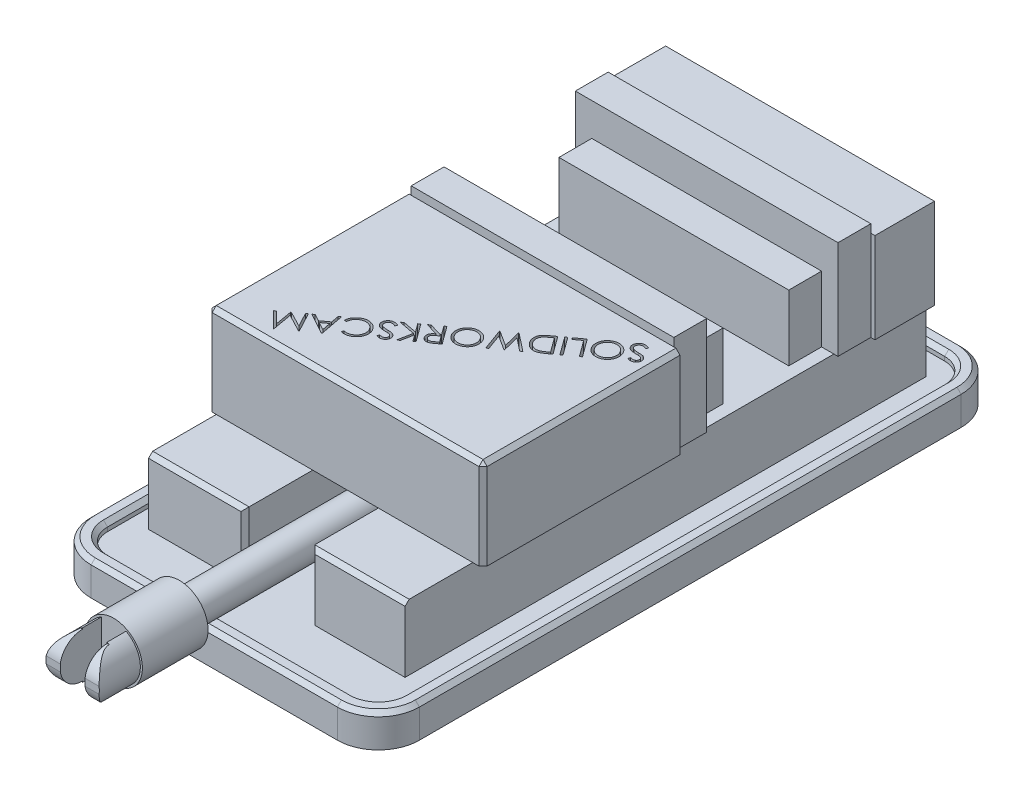
from build123d import *
from build123d.topology import SkipClean

# Parameters (mm, degrees)
SKETCH1_W               = 203.2
SKETCH1_H               = 76.2
BASE_EXTRUDE_DEPTH      = 25.4
SKETCH2_W               = 212.725
SKETCH2_H               = 69.85
BOSS_EXTRUDE1_DEPTH     = 152.4
SKETCH3_W               = 73.025
SKETCH3_H               = 406.4
SKETCH3_W_2             = 74.6125
BOSS_EXTRUDE2_DEPTH     = 50.8
SKETCH4_W               = 211.1375
SKETCH4_H               = 49.2125
BOSS_EXTRUDE3_DEPTH     = 69.85
SKETCH5_W               = 203.2
SKETCH5_H               = 76.2
BOSS_EXTRUDE4_DEPTH     = 25.4
BOSS_EXTRUDE5_DEPTH     = 19.05
BOSS_EXTRUDE6_START     = -25.4
BOSS_EXTRUDE6_DEPTH     = 25.4
BOSS_EXTRUDE7_DEPTH     = 50.8
SKETCH9_R               = 12.699199964
BOSS_EXTRUDE8_DEPTH     = 482.6
SKETCH10_R              = 22.225
BOSS_EXTRUDE9_DEPTH     = 50.8
BOSS_EXTRUDE10_DEPTH    = 31.75
CUT_EXTRUDE3_DEPTH      = 31.75
CUT_EXTRUDE3_DEPTH_BACK = 393.549301243
SKETCH19_W              = 177.8
SKETCH19_H              = 50.8
BOSS_EXTRUDE14_DEPTH    = 25.4
SKETCH20_W              = 177.8
SKETCH20_H              = 50.8
BOSS_EXTRUDE15_DEPTH    = 25.4
CHAMFER1_SIZE           = 3.175
CUT_EXTRUDE4_DEPTH      = 25.146


with BuildPart() as part:
    # Sketch1 → Base-Extrude (new body)
    with BuildSketch(Plane.XY):
        with Locations((0, 38.1)):
            Rectangle(SKETCH1_W, SKETCH1_H)
    extrude(amount=-BASE_EXTRUDE_DEPTH)

    # Sketch2 → Boss-Extrude1 (add)
    with BuildSketch(Plane.XY):
        with Locations((0, 34.925)):
            Rectangle(SKETCH2_W, SKETCH2_H)
    extrude(amount=BOSS_EXTRUDE1_DEPTH)

    # Sketch3 → Boss-Extrude2 (add)
    with BuildSketch(Plane.XZ):
        with Locations((61.9125, 1.5875)):
            Rectangle(SKETCH3_W, SKETCH3_H)
        with Locations((-62.70625, 1.5875)):
            Rectangle(SKETCH3_W_2, SKETCH3_H)
    extrude(amount=BOSS_EXTRUDE2_DEPTH)

    # Sketch4 → Boss-Extrude3 (add)
    with BuildSketch(Plane(origin=(0, 0, 0), x_dir=(-1, 0, 0), z_dir=(0, 1, 0))):
        with Locations((0.79375, -177.00625)):
            Rectangle(SKETCH4_W, SKETCH4_H)
    extrude(amount=BOSS_EXTRUDE3_DEPTH)

    # Sketch5 → Boss-Extrude4 (add)
    with BuildSketch(Plane.XY.offset(-152.4)):
        with Locations((0, 38.1)):
            Rectangle(SKETCH5_W, SKETCH5_H)
    extrude(amount=BOSS_EXTRUDE4_DEPTH)

    # Sketch6 → Boss-Extrude5 (add)
    with BuildSketch(Plane.XZ.offset(50.8)):
        with BuildLine():
            Line((-95.25, 254), (95.25, 254))
            ThreePointArc((95.25, 254), (117.700640303, 244.700640303), (127, 222.25))
            Line((127, 222.25), (127, -196.85))
            ThreePointArc((127, -196.85), (117.700640303, -219.300640303), (95.25, -228.6))
            Line((95.25, -228.6), (-95.25, -228.6))
            ThreePointArc((-95.25, -228.6), (-117.700640303, -219.300640303), (-127, -196.85))
            Line((-127, -196.85), (-127, 222.25))
            ThreePointArc((-127, 222.25), (-117.700640303, 244.700640303), (-95.25, 254))
        make_face()
    extrude(amount=BOSS_EXTRUDE5_DEPTH)

    # Sketch7 → Boss-Extrude6 (add)
    with SkipClean():  # the faces are left unmerged after this step: merging them gives an invalid solid
        with BuildSketch(Plane.XZ.offset(69.85).offset(BOSS_EXTRUDE6_START)):
            with BuildLine():
                Line((95.25, 254), (-95.25, 254))
                ThreePointArc((-95.25, 254), (-117.700640303, 244.700640303), (-127, 222.25))
                Line((-127, 222.25), (-127, -196.85))
                ThreePointArc((-127, -196.85), (-117.700640303, -219.300640303), (-95.25, -228.6))
                Line((-95.25, -228.6), (95.25, -228.6))
                ThreePointArc((95.25, -228.6), (117.700640303, -219.300640303), (127, -196.85))
                Line((127, -196.85), (127, 222.25))
                ThreePointArc((127, 222.25), (117.700640303, 244.700640303), (95.25, 254))
            make_face()
            with BuildLine():
                Line((95.25, 241.3), (-95.25, 241.3))
                ThreePointArc((-95.25, 241.3), (-108.720384182, 235.720384182), (-114.3, 222.25))
                Line((-114.3, 222.25), (-114.3, -196.85))
                ThreePointArc((-114.3, -196.85), (-108.720384182, -210.320384182), (-95.25, -215.9))
                Line((-95.25, -215.9), (95.25, -215.9))
                ThreePointArc((95.25, -215.9), (108.720384182, -210.320384182), (114.3, -196.85))
                Line((114.3, -196.85), (114.3, 222.25))
                ThreePointArc((114.3, 222.25), (108.720384182, 235.720384182), (95.25, 241.3))
            make_face(mode=Mode.SUBTRACT)
        extrude(amount=BOSS_EXTRUDE6_DEPTH)
    add(part.part.scale(1), mode=Mode.REPLACE)  # the faces are merged on a copy

    # Sketch8 → Boss-Extrude7 (add)
    with BuildSketch(Plane(origin=(0, 0, -201.6125), x_dir=(-1, 0, 0), z_dir=(0, 0, -1))):
        with BuildLine():
            Line((-19.05, 0), (19.05, 0))
            Line((19.05, 0), (19.05, -19.05254))
            ThreePointArc((19.05, -19.05254), (13.47112813, -32.52112813), (0.00254, -38.1))
            Line((0.00254, -38.1), (-0.00254, -38.1))
            ThreePointArc((-0.00254, -38.1), (-13.47112813, -32.52112813), (-19.05, -19.05254))
            Line((-19.05, -19.05254), (-19.05, 0))
        make_face()
    extrude(amount=-BOSS_EXTRUDE7_DEPTH)

    # Sketch9 → Boss-Extrude8 (add)
    with BuildSketch(Plane.XY.offset(-150.8125)):
        with Locations((-0.00254, -19.05254)):
            Circle(SKETCH9_R)
    extrude(amount=BOSS_EXTRUDE8_DEPTH)

    # Sketch10 → Boss-Extrude9 (add)
    with BuildSketch(Plane.XY.offset(331.7875)):
        with Locations((-0.00254, -19.05254)):
            Circle(SKETCH10_R)
    extrude(amount=-BOSS_EXTRUDE9_DEPTH)

    # Sketch12 → Boss-Extrude10 (add)
    with BuildSketch(Plane.XY.offset(331.7875)):
        with BuildLine():
            Line((-9.564689525, -0.762760718), (-9.564689525, -37.337239282))
            ThreePointArc((-9.564689525, -37.337239282), (-20.6375, -19.05), (-9.564689525, -0.762760718))
        make_face()
        with BuildLine():
            Line((9.559609525, -0.760104648), (9.559609525, -37.339895352))
            ThreePointArc((9.559609525, -37.339895352), (20.6375, -19.05), (9.559609525, -0.760104648))
        make_face()
    extrude(amount=BOSS_EXTRUDE10_DEPTH)

    # Sketch13 → Cut-Extrude3 (cut, two sides: drawn at the far end of the back side and taken through both)
    with BuildSketch(Plane(origin=(0, 0, 0), x_dir=(0, 0, -1), z_dir=(1, 0, 0)).offset(-CUT_EXTRUDE3_DEPTH_BACK)):
        with BuildLine():
            Line((-346.37408333, 4.528931237), (-346.37408333, -1.682007362))
            ThreePointArc((-346.37408333, -1.682007362), (-363.744615968, -19.05254), (-346.37408333, -36.423072638))
            Line((-346.37408333, -36.423072638), (-346.37408333, -44.712752589))
            Line((-346.37408333, -44.712752589), (-380.000690716, -44.712752589))
            Line((-380.000690716, -44.712752589), (-380.000690716, 4.528931237))
            Line((-380.000690716, 4.528931237), (-346.37408333, 4.528931237))
        make_face()
    extrude(amount=CUT_EXTRUDE3_DEPTH + CUT_EXTRUDE3_DEPTH_BACK, mode=Mode.SUBTRACT)

    # Sketch19 → Boss-Extrude14 (add)
    with BuildSketch(Plane.XY.offset(-127)):
        with Locations((0, 25.4)):
            Rectangle(SKETCH19_W, SKETCH19_H)
    extrude(amount=BOSS_EXTRUDE14_DEPTH)

    # Sketch20 → Boss-Extrude15 (add)
    with BuildSketch(Plane(origin=(0, 0, -25.4), x_dir=(-1, 0, 0), z_dir=(0, 0, -1))):
        with Locations((0, 25.4)):
            Rectangle(SKETCH20_W, SKETCH20_H)
    extrude(amount=BOSS_EXTRUDE15_DEPTH)

    # Chamfer1
    chamfer1_edges = [part.edges().sort_by_distance(p)[0] for p in [
        (-127, -44.45, 12.7),
        (-117.700640303, -44.45, -219.300640303),
        (0, -44.45, -228.6),
        (117.700640303, -44.45, -219.300640303),
        (127, -44.45, 12.7),
        (117.700640303, -44.45, 244.700640303),
        (0, -44.45, 254),
        (-117.700640303, -44.45, 244.700640303),
        (-114.3, -44.45, 12.7),
        (-108.720384182, -44.45, 235.720384182),
        (0, -44.45, 241.3),
        (108.720384182, -44.45, 235.720384182),
        (114.3, -44.45, 12.7),
        (108.720384182, -44.45, -210.320384182),
        (0, -44.45, -215.9),
        (-108.720384182, -44.45, -210.320384182),
        (-106.3625, 69.85, 76.2),
        (0, 69.85, 152.4),
        (106.3625, 69.85, 76.2),
        (106.3625, 34.925, 152.4),
        (-106.3625, 34.925, 152.4),
        (-62.70625, 0, 204.7875),
        (-25.4, -25.4, 204.7875),
        (25.4, -25.4, 204.7875),
        (61.9125, 0, 204.7875),
        (-0.79375, 69.85, -201.6125),
        (98.425, -25.4, -201.6125),
        (-106.3625, 34.925, -201.6125),
        (-106.3625, 69.85, -177.00625),
        (104.775, 34.925, -201.6125),
    ]]
    chamfer(chamfer1_edges, length=CHAMFER1_SIZE)

    # Sketch22 → Cut-Extrude4 (cut)
    # profile 1 of 13: a face of its own
    with BuildSketch(Plane(origin=(0, 69.85, 0), x_dir=(1, 0, 0), z_dir=(0, 1, 0))):
        with BuildLine():
            Line((92.527463112, -10.540060509), (91.869449874, -12.097243668))
            add(Edge.make_bspline(
                [(91.869449874, -12.097243668), (91.636849195, -11.992120084), (91.191036655, -11.790635668), (90.523261601, -11.565259871), (89.895784886, -11.417570562), (89.30706042, -11.346591758), (88.756252994, -11.362336261), (88.244406919, -11.458527588), (87.768507937, -11.63214096), (87.491209245, -11.813753994), (87.352929692, -11.904318321)],
                knots=[0, 0, 0, 0, 1.289584394, 2.471673337, 3.555850438, 4.542984992, 5.460549554, 6.32914657, 7.166801455, 8, 8, 8, 8], degree=3))
            add(Edge.make_bspline(
                [(87.352929692, -11.904318321), (87.241216605, -11.990963702), (87.019564241, -12.162878686), (86.734363993, -12.471639433), (86.482280208, -12.806835889), (86.279780612, -13.173227984), (86.118150678, -13.553195096), (86.019821647, -13.942636903), (85.967646633, -14.331576187), (85.980319488, -14.718021701), (86.041546918, -15.094724413), (86.153435688, -15.452615474), (86.304231117, -15.794625122), (86.442480987, -16.000087692), (86.512326393, -16.103889719)],
                knots=[0, 0, 0, 0, 1.066787525, 2.116636321, 3.165049229, 4.229716464, 5.272510518, 6.276592689, 7.256183679, 8.228558787, 9.18736085, 10.131717231, 11.056122299, 12, 12, 12, 12], degree=3))
            add(Edge.make_bspline(
                [(86.512326393, -16.103889719), (86.601455847, -16.215619372), (86.78145466, -16.441259764), (87.129109986, -16.715248047), (87.524771066, -16.950701311), (87.818265068, -17.062529831), (87.969601784, -17.120192887)],
                knots=[0, 0, 0, 0, 0.947949628, 1.914404271, 2.924587197, 4, 4, 4, 4], degree=3))
            add(Edge.make_bspline(
                [(87.969601784, -17.120192887), (88.086301068, -17.157328758), (88.331245117, -17.235274485), (88.725415307, -17.325904552), (89.160288874, -17.403814685), (89.635833094, -17.473073636), (90.153021501, -17.527490541), (90.712666502, -17.567188146), (91.313324215, -17.599434016), (91.728158808, -17.608283892), (91.941796879, -17.612841542)],
                knots=[0, 0, 0, 0, 0.731512575, 1.535396331, 2.414267451, 3.371086653, 4.40619316, 5.520847763, 6.72324702, 8, 8, 8, 8], degree=3))
            add(Edge.make_bspline(
                [(91.941796879, -17.612841542), (92.155423565, -17.616378489), (92.56327344, -17.623131127), (93.145420604, -17.649281025), (93.671490723, -17.675930219), (94.140578752, -17.707409774), (94.552497463, -17.75476046), (94.907340958, -17.79903227), (95.205077014, -17.857238922), (95.382505036, -17.904836131), (95.462684466, -17.926345231)],
                knots=[0, 0, 0, 0, 1.447299741, 2.763142715, 3.947245518, 5.015856367, 5.947110541, 6.755754828, 7.437727658, 8, 8, 8, 8], degree=3))
            add(Edge.make_bspline(
                [(95.462684466, -17.926345231), (95.58056985, -17.964497704), (95.813003876, -18.039722745), (96.143961423, -18.186245704), (96.456235098, -18.35350019), (96.752068394, -18.536897781), (97.026988231, -18.746469524), (97.281510047, -18.977083401), (97.517661793, -19.22968054), (97.658625991, -19.412304848), (97.729557296, -19.504198963)],
                knots=[0, 0, 0, 0, 1.057224301, 2.084523907, 3.084514982, 4.080074901, 5.052633029, 6.03129926, 7.009376052, 8, 8, 8, 8], degree=3))
            add(Edge.make_bspline(
                [(97.729557296, -19.504198963), (97.831610188, -19.654340657), (98.032874613, -19.950443793), (98.255337357, -20.436251848), (98.417705634, -20.93752903), (98.502049015, -21.456606811), (98.519549458, -21.978818251), (98.468932626, -22.499956665), (98.338659276, -23.013214931), (98.137771569, -23.512972904), (97.879915587, -23.991934269), (97.552099758, -24.428312465), (97.179323318, -24.833533344), (96.887829447, -25.060404141), (96.740814891, -25.174826134)],
                knots=[0, 0, 0, 0, 1.016618104, 2.004931493, 2.984708335, 3.964146403, 4.943669175, 5.908190909, 6.89075818, 7.902590824, 8.922935763, 9.931586051, 10.956798108, 12, 12, 12, 12], degree=3))
            add(Edge.make_bspline(
                [(96.740814891, -25.174826134), (96.576047089, -25.286622285), (96.250730754, -25.507351784), (95.712782706, -25.750413209), (95.153434141, -25.932989012), (94.661827338, -26.020213077), (94.250361042, -26.046615784), (93.917727304, -26.04672379), (93.563306115, -26.021905431), (93.187680021, -25.971904361), (92.790761326, -25.903650715), (92.372651013, -25.809117895), (91.932838013, -25.691949387), (91.633759656, -25.600668284), (91.480154084, -25.553786637)],
                knots=[0, 0, 0, 0, 1.300833517, 2.568356119, 3.846924203, 5.144171305, 5.822000152, 6.543416218, 7.31922097, 8.145057539, 9.022225646, 9.953872906, 10.949116456, 12, 12, 12, 12], degree=3))
            Line((91.480154084, -25.553786637), (91.979692929, -23.879470231))
            add(Edge.make_bspline(
                [(91.979692929, -23.879470231), (92.103485109, -23.915923874), (92.342180476, -23.98621358), (92.690966375, -24.074049093), (93.013763089, -24.153137227), (93.315670488, -24.206425562), (93.593368762, -24.250037778), (93.848821019, -24.272728666), (94.081186074, -24.286798199), (94.358617692, -24.271457368), (94.684065435, -24.218851937), (95.054696075, -24.108092749), (95.409143422, -23.949757461), (95.623106798, -23.804733397), (95.731401914, -23.731331125)],
                knots=[0, 0, 0, 0, 1.187067904, 2.2888975, 3.308821533, 4.243370459, 5.108456412, 5.893739077, 6.602287596, 7.247517201, 8.445954716, 9.625855067, 10.798353687, 12, 12, 12, 12], degree=3))
            add(Edge.make_bspline(
                [(95.731401914, -23.731331125), (95.860770247, -23.627842449), (96.109598268, -23.428791555), (96.405966748, -23.064620212), (96.618132703, -22.665924665), (96.736960103, -22.236761862), (96.772998743, -21.801109018), (96.719984089, -21.374683104), (96.582584171, -20.964161026), (96.422834068, -20.722999809), (96.341183815, -20.599739328)],
                knots=[0, 0, 0, 0, 1.112729936, 2.140233081, 3.136161332, 4.132239597, 5.117094427, 6.059685676, 7.008281355, 8, 8, 8, 8], degree=3))
            add(Edge.make_bspline(
                [(96.341183815, -20.599739328), (96.285352929, -20.527169859), (96.174008883, -20.382443904), (95.977243149, -20.188570016), (95.761583906, -20.0123841), (95.518228328, -19.858684659), (95.244409987, -19.721625817), (94.928080007, -19.605076305), (94.565710031, -19.509450244), (94.30670899, -19.465338868), (94.170773659, -19.442187245)],
                knots=[0, 0, 0, 0, 0.867178935, 1.729422888, 2.611912937, 3.502891555, 4.452351705, 5.510006907, 6.69314025, 8, 8, 8, 8], degree=3))
            add(Edge.make_bspline(
                [(94.170773659, -19.442187245), (94.122564454, -19.437328082), (94.006783092, -19.425658101), (93.803368177, -19.413273727), (93.54275677, -19.398888581), (93.223430179, -19.388942612), (92.846669023, -19.384454835), (92.410388176, -19.371449078), (91.916547146, -19.365659989), (91.567430382, -19.363884489), (91.38369141, -19.362950048)],
                knots=[0, 0, 0, 0, 0.416923193, 1.00130121, 1.753374786, 2.663004539, 3.750207212, 4.995695544, 6.418844734, 8, 8, 8, 8], degree=3))
            add(Edge.make_bspline(
                [(91.38369141, -19.362950048), (91.162005613, -19.361255383), (90.731038795, -19.35796088), (90.106248084, -19.324367434), (89.522270458, -19.282273897), (88.981359396, -19.218769099), (88.480310564, -19.146669103), (88.022253626, -19.04838587), (87.603747196, -18.940497624), (87.223919692, -18.812124402), (86.876899743, -18.664534075), (86.551727436, -18.508169862), (86.249980107, -18.330071108), (85.967971772, -18.137900771), (85.705394594, -17.930785118), (85.462503478, -17.709665413), (85.241273181, -17.472138097), (85.110030462, -17.301550718), (85.044715716, -17.216655561)],
                knots=[0, 0, 0, 0, 1.53048903, 2.97533714, 4.319303087, 5.572316762, 6.735185142, 7.812863514, 8.805260991, 9.717961707, 10.577960733, 11.407748771, 12.207363763, 12.994697588, 13.762464251, 14.514511584, 15.26072624, 16, 16, 16, 16], degree=3))
            add(Edge.make_bspline(
                [(85.044715716, -17.216655561), (84.958274143, -17.090817811), (84.788011727, -16.842957455), (84.579747526, -16.445647199), (84.417347439, -16.034408707), (84.29963653, -15.60931347), (84.22830854, -15.171577226), (84.194977355, -14.72047739), (84.215870533, -14.255696854), (84.272578775, -13.782778565), (84.37449982, -13.315264541), (84.5209914, -12.865085522), (84.702534515, -12.435724843), (84.928011964, -12.030589976), (85.194742251, -11.649650877), (85.50335897, -11.293482542), (85.852864593, -10.961196253), (86.109752451, -10.761842534), (86.24016385, -10.660638851)],
                knots=[0, 0, 0, 0, 0.989411477, 1.94882603, 2.901685663, 3.85206825, 4.803384128, 5.773863302, 6.779951428, 7.81546123, 8.85993065, 9.877366302, 10.881661166, 11.878444743, 12.878422658, 13.892199342, 14.929956301, 16, 16, 16, 16], degree=3))
            add(Edge.make_bspline(
                [(86.24016385, -10.660638851), (86.344687431, -10.586572414), (86.55211207, -10.439589277), (86.880359827, -10.251217874), (87.215931628, -10.089189189), (87.557990307, -9.949457545), (87.909614513, -9.839499707), (88.269289261, -9.757601946), (88.635049546, -9.697801775), (89.010545581, -9.66715374), (89.397457204, -9.663486066), (89.799629244, -9.691048178), (90.217080286, -9.75521506), (90.650823535, -9.848223449), (91.099175542, -9.9732978), (91.562819326, -10.129055473), (92.041626793, -10.319312123), (92.362695973, -10.465195624), (92.527463112, -10.540060509)],
                knots=[0, 0, 0, 0, 0.92534472, 1.836325277, 2.730827184, 3.616935999, 4.504093442, 5.38985244, 6.280766989, 7.180144648, 8.109647908, 9.074595952, 10.089801413, 11.159188719, 12.278635749, 13.451706468, 14.69225992, 16, 16, 16, 16], degree=3))
        make_face()
    # profile 2 of 13: a face of its own
    with BuildSketch(Plane(origin=(0, 69.85, 0), x_dir=(1, 0, 0), z_dir=(0, 1, 0))):
        with BuildLine():
            add(Edge.make_bspline(
                [(83.342431649, -34.939244306), (83.08273212, -35.120116097), (82.571976628, -35.475839733), (81.760330143, -35.913201), (80.935718303, -36.263237343), (80.094349312, -36.524736717), (79.237734249, -36.696307053), (78.364112735, -36.785464948), (77.475332689, -36.774690066), (76.581131734, -36.683489238), (75.702527454, -36.504700938), (74.855841451, -36.250335264), (74.053985437, -35.914476343), (73.294467098, -35.503060021), (72.580848259, -35.010804022), (71.91381646, -34.437092711), (71.285948586, -33.789459778), (70.914836196, -33.306682714), (70.726491978, -33.061667267)],
                knots=[0, 0, 0, 0, 1.066441495, 2.097388672, 3.102091783, 4.083138181, 5.062769814, 6.043357593, 7.038546475, 8.054587432, 9.069912406, 10.057228021, 11.030941396, 11.996062821, 12.964890213, 13.948112127, 14.958641033, 16, 16, 16, 16], degree=3))
            add(Edge.make_bspline(
                [(70.726491978, -33.061667267), (70.552883156, -32.809764311), (70.210357302, -32.312766095), (69.785734138, -31.52359882), (69.450001782, -30.71411481), (69.200024825, -29.886632274), (69.037107827, -29.039344778), (68.960550776, -28.172347288), (68.977650318, -27.286276695), (69.073264221, -26.392641047), (69.249115337, -25.510580452), (69.509266862, -24.664662674), (69.839721486, -23.859980824), (70.25693984, -23.105338035), (70.744025473, -22.389638327), (71.312592299, -21.723952114), (71.956581815, -21.101765356), (72.433863474, -20.733026775), (72.676416024, -20.545635366)],
                knots=[0, 0, 0, 0, 1.040502578, 2.052885498, 3.042783807, 4.018229136, 4.989280898, 5.973919924, 6.974459926, 8.000269744, 9.02877806, 10.030065684, 11.007637906, 11.983521503, 12.959060764, 13.948804787, 14.957591147, 16, 16, 16, 16], degree=3))
            add(Edge.make_bspline(
                [(72.676416024, -20.545635366), (72.931639436, -20.369480183), (73.433984795, -20.022761449), (74.231834683, -19.596435709), (75.044540857, -19.250192497), (75.878052396, -18.999431786), (76.728409374, -18.832187303), (77.597711118, -18.752249701), (78.485098504, -18.76489282), (79.37900907, -18.860688722), (80.257115985, -19.039525321), (81.103587361, -19.288523934), (81.901710837, -19.622916778), (82.658461834, -20.025131189), (83.363039409, -20.511401696), (84.022443072, -21.071504109), (84.638819896, -21.704498121), (85.001790408, -22.17706676), (85.185557734, -22.416322214)],
                knots=[0, 0, 0, 0, 1.056045812, 2.078569941, 3.076460813, 4.061874084, 5.038851692, 6.025196943, 7.030975195, 8.058198582, 9.08428835, 10.080943101, 11.05986242, 12.028054136, 12.996269577, 13.970830318, 14.972657357, 16, 16, 16, 16], degree=3))
            add(Edge.make_bspline(
                [(85.185557734, -22.416322214), (85.302537365, -22.582557704), (85.534244888, -22.911828817), (85.842417841, -23.428308906), (86.10976934, -23.959196029), (86.34520262, -24.501846039), (86.546497714, -25.055502566), (86.704499999, -25.6250498), (86.827970392, -26.206188814), (86.917695542, -26.797372728), (86.970092534, -27.38996108), (86.979732697, -27.979297837), (86.952444907, -28.561586407), (86.88742858, -29.137170956), (86.782572289, -29.70542984), (86.643282952, -30.266957319), (86.457474763, -30.820500246), (86.239089759, -31.36525876), (85.984915345, -31.894817653), (85.697748339, -32.401197016), (85.384802029, -32.88699093), (85.035239526, -33.344010994), (84.65814244, -33.780294572), (84.252518673, -34.194139658), (83.812669392, -34.581892931), (83.500122159, -34.819409347), (83.342431649, -34.939244306)],
                knots=[0, 0, 0, 0, 1.038810668, 2.057625269, 3.070979747, 4.075333889, 5.079893869, 6.079760542, 7.094083704, 8.115229422, 9.134585047, 10.132675252, 11.125850771, 12.112499327, 13.091187658, 14.077836214, 15.067257461, 16.073394137, 17.076357765, 18.067327633, 19.047511234, 20.027853023, 21.005854524, 21.993794482, 22.987802359, 24, 24, 24, 24], degree=3))
        make_face()
        with BuildLine():
            add(Edge.make_bspline(
                [(82.291677525, -33.636998213), (82.417044604, -33.542211102), (82.666367809, -33.353703669), (83.015600482, -33.041869154), (83.338118513, -32.707299676), (83.640843286, -32.353864536), (83.918121683, -31.978959769), (84.175777268, -31.584426105), (84.405488199, -31.166857421), (84.612163589, -30.731033442), (84.787994573, -30.282180682), (84.943645634, -29.829668114), (85.059095012, -29.370597174), (85.145632407, -28.909227985), (85.201309436, -28.44428154), (85.225190493, -27.975837191), (85.218149478, -27.502853946), (85.180367945, -27.028711905), (85.111632227, -26.556806785), (85.011496133, -26.090681367), (84.880207157, -25.631486434), (84.71828053, -25.1802356), (84.525064383, -24.736368998), (84.295156294, -24.303813342), (84.042770421, -23.874403639), (83.849703607, -23.601283621), (83.752398011, -23.463631242)],
                knots=[0, 0, 0, 0, 0.989619549, 1.968101354, 2.945084964, 3.914758696, 4.897002623, 5.880045145, 6.880443177, 7.896382757, 8.915817964, 9.915352761, 10.908270832, 11.894209467, 12.870309134, 13.855292197, 14.84631166, 15.847624431, 16.849041691, 17.84776489, 18.848241362, 19.854895201, 20.865439253, 21.894248246, 22.938701969, 24, 24, 24, 24], degree=3))
            add(Edge.make_bspline(
                [(83.752398011, -23.463631242), (83.600930708, -23.266599122), (83.302865808, -22.878869505), (82.800452821, -22.35586056), (82.258936632, -21.899897865), (81.686132482, -21.499127681), (81.072239719, -21.168535231), (80.424859675, -20.898427223), (79.741591492, -20.690967082), (79.031847277, -20.549185497), (78.312458202, -20.469201122), (77.60170933, -20.457948084), (76.906843635, -20.516571442), (76.229143111, -20.644317243), (75.567424822, -20.841552434), (74.92350124, -21.1104627), (74.293118841, -21.44221744), (73.899051938, -21.716137185), (73.699609383, -21.85477165)],
                knots=[0, 0, 0, 0, 1.052008644, 2.070194986, 3.064092479, 4.046270668, 5.025602796, 6.011050994, 7.012641885, 8.044696496, 9.072168336, 10.07418425, 11.050419745, 12.020529856, 12.98996918, 13.969059737, 14.972113838, 16, 16, 16, 16], degree=3))
            add(Edge.make_bspline(
                [(73.699609383, -21.85477165), (73.569561986, -21.952912781), (73.310894273, -22.148118087), (72.950458411, -22.470500577), (72.610847563, -22.808472238), (72.296442132, -23.166617296), (72.011044833, -23.547098511), (71.748826209, -23.94402198), (71.509051911, -24.358039707), (71.301526549, -24.791117994), (71.117954592, -25.234527322), (70.96712331, -25.685995091), (70.84501921, -26.140071088), (70.75995111, -26.599982696), (70.699948952, -27.062155282), (70.675519536, -27.529785222), (70.688248574, -28.000360789), (70.724764013, -28.473336113), (70.792517238, -28.945784104), (70.897734196, -29.409911026), (71.028075039, -29.867292977), (71.191049735, -30.315884147), (71.383162368, -30.757285414), (71.60991774, -31.187951819), (71.859585992, -31.615374893), (72.051921052, -31.887097563), (72.149316414, -32.024693525)],
                knots=[0, 0, 0, 0, 1.022154199, 2.033091739, 3.031984956, 4.027987767, 5.021170219, 6.014666439, 7.012336813, 8.021294112, 9.02646012, 10.022462931, 11.006713705, 11.975001734, 12.955683544, 13.929988251, 14.910431668, 15.908206172, 16.906084795, 17.902817508, 18.892830569, 19.889146261, 20.896119425, 21.911568728, 22.942452202, 24, 24, 24, 24], degree=3))
            add(Edge.make_bspline(
                [(72.149316414, -32.024693525), (72.249822352, -32.158113315), (72.448766819, -32.422208447), (72.774155349, -32.791036987), (73.116690878, -33.132991122), (73.473088987, -33.450064277), (73.849047609, -33.738009324), (74.239451671, -33.999730431), (74.649664771, -34.230420375), (75.071554884, -34.438857806), (75.508597682, -34.610872918), (75.950712915, -34.763672805), (76.403525465, -34.873881937), (76.86173661, -34.963389112), (77.32970682, -35.012309606), (77.803551639, -35.037852725), (78.285734005, -35.030059645), (78.771374173, -34.992859292), (79.254371402, -34.923491335), (79.727967608, -34.828538868), (80.187554837, -34.699105011), (80.635533444, -34.544936203), (81.07042536, -34.3616532), (81.492533071, -34.151553345), (81.900350383, -33.90940805), (82.160683275, -33.728185658), (82.291677525, -33.636998213)],
                knots=[0, 0, 0, 0, 1.052047428, 2.082454216, 3.095365473, 4.099922787, 5.085358454, 6.076593111, 7.058303714, 8.048402436, 9.038527589, 10.015427953, 10.992783629, 11.971851524, 12.954547981, 13.954221738, 14.9599507, 15.990357488, 17.020662678, 18.032307133, 19.031064202, 20.026330159, 21.015265178, 22.00208086, 22.994687468, 24, 24, 24, 24], degree=3))
        make_face(mode=Mode.SUBTRACT)
    # profile 3 of 13: a face of its own
    with BuildSketch(Plane(origin=(0, 69.85, 0), x_dir=(1, 0, 0), z_dir=(0, 1, 0))):
        Polygon((72.903466811, -42.008310023), (71.518538426, -43.017723001), (62.44071182, -30.570593009), (57.149045153, -34.429099954), (56.180973322, -33.099293096), (62.857568374, -28.231373174), align=None)
    # profile 4 of 13: a face of its own
    with BuildSketch(Plane(origin=(0, 69.85, 0), x_dir=(1, 0, 0), z_dir=(0, 1, 0))):
        Polygon((64.190060782, -48.359456367), (62.815467683, -49.361979154), (52.769569245, -35.585042305), (54.144162344, -34.582519518), align=None)
    # profile 5 of 13: a face of its own
    with BuildSketch(Plane(origin=(0, 69.85, 0), x_dir=(1, 0, 0), z_dir=(0, 1, 0))):
        with BuildLine():
            Line((49.671099195, -37.840118157), (59.716997632, -51.617055006))
            Line((59.716997632, -51.617055006), (56.861013474, -53.701337775))
            add(Edge.make_bspline(
                [(56.861013474, -53.701337775), (56.611577007, -53.881768426), (56.130380672, -54.229843303), (55.42030581, -54.712145231), (54.752501518, -55.140898785), (54.124529437, -55.51324603), (53.54011019, -55.836018478), (52.996177745, -56.101245425), (52.494886157, -56.31709895), (52.168448681, -56.423989058), (52.013764125, -56.474639642)],
                knots=[0, 0, 0, 0, 1.317658447, 2.541939527, 3.673678674, 4.713934314, 5.666419943, 6.53037129, 7.303606725, 8, 8, 8, 8], degree=3))
            add(Edge.make_bspline(
                [(52.013764125, -56.474639642), (51.805503997, -56.531671114), (51.393401145, -56.644524363), (50.76802312, -56.758845585), (50.145586595, -56.817068364), (49.527873643, -56.824644187), (48.913761954, -56.778791583), (48.303385395, -56.684028034), (47.698673939, -56.528658921), (47.098594954, -56.330592763), (46.512586179, -56.079409078), (45.943490322, -55.781183222), (45.395810866, -55.435876067), (44.866242221, -55.044285777), (44.356689307, -54.607365368), (43.869515391, -54.120797783), (43.399620698, -53.591453951), (43.110301027, -53.209546286), (42.963498283, -53.015763774)],
                knots=[0, 0, 0, 0, 0.998430295, 1.975682885, 2.936030166, 3.886870578, 4.829560757, 5.781409484, 6.73987471, 7.714091224, 8.70168236, 9.685294547, 10.68298987, 11.693288516, 12.72916455, 13.784575427, 14.875878701, 16, 16, 16, 16], degree=3))
            add(Edge.make_bspline(
                [(42.963498283, -53.015763774), (42.841795185, -52.843859039), (42.602156276, -52.505370838), (42.286723333, -51.978784273), (42.003318254, -51.450921228), (41.768550006, -50.913674556), (41.56579895, -50.37384637), (41.404663328, -49.829110295), (41.278401111, -49.279511355), (41.197360281, -48.726392626), (41.153075822, -48.178533683), (41.14242928, -47.64125055), (41.164520953, -47.117184799), (41.22904813, -46.607852889), (41.318814607, -46.110104582), (41.456725029, -45.629274704), (41.6202879, -45.157992927), (41.825475699, -44.698693492), (42.078135831, -44.245574747), (42.377985683, -43.791393616), (42.730902518, -43.334825933), (43.141783407, -42.88119368), (43.598582454, -42.417981827), (44.114919115, -41.95845355), (44.679667816, -41.492063812), (45.0820477, -41.191636344), (45.288937737, -41.037166769)],
                knots=[0, 0, 0, 0, 1.090485369, 2.147215036, 3.176851081, 4.191380099, 5.181254859, 6.161668083, 7.131269729, 8.099410967, 9.054159828, 9.97620754, 10.881198002, 11.767926283, 12.633457704, 13.497823562, 14.355595894, 15.215530551, 16.099381913, 17.039645376, 18.031804575, 19.084845586, 20.207741951, 21.399590292, 22.662957861, 24, 24, 24, 24], degree=3))
            Line((45.288937737, -41.037166769), (49.671099195, -37.840118157))
        make_face()
        with BuildLine():
            Line((49.302473978, -40.103545892), (47.710839863, -41.264543071))
            add(Edge.make_bspline(
                [(47.710839863, -41.264543071), (47.482721092, -41.432368835), (47.044226287, -41.754967126), (46.425425616, -42.234609078), (45.865399282, -42.680146739), (45.371742718, -43.102415799), (44.938067073, -43.492388706), (44.56692839, -43.853538287), (44.261302288, -44.187686719), (44.087766347, -44.407826161), (44.007362216, -44.509823019)],
                knots=[0, 0, 0, 0, 1.376152824, 2.645270544, 3.804391227, 4.853350697, 5.801565838, 6.638148077, 7.369015316, 8, 8, 8, 8], degree=3))
            add(Edge.make_bspline(
                [(44.007362216, -44.509823019), (43.912113397, -44.647326581), (43.724609863, -44.918011344), (43.484584065, -45.345172157), (43.290680125, -45.784121311), (43.124598817, -46.230166151), (43.005144052, -46.688517889), (42.925816112, -47.156634371), (42.884810165, -47.633631461), (42.880739685, -48.118698174), (42.918967927, -48.60851774), (42.998760898, -49.098108114), (43.118323697, -49.586433979), (43.288437742, -50.068571127), (43.486110398, -50.554529403), (43.7330345, -51.035607115), (44.018242829, -51.51648434), (44.237115661, -51.825222023), (44.348426669, -51.982235128)],
                knots=[0, 0, 0, 0, 0.997903191, 1.964437752, 2.918451146, 3.859377588, 4.801900006, 5.740427397, 6.689752251, 7.656092416, 8.63217711, 9.618029117, 10.613670555, 11.627959546, 12.66650083, 13.742294936, 14.851810776, 16, 16, 16, 16], degree=3))
            add(Edge.make_bspline(
                [(44.348426669, -51.982235128), (44.470206486, -52.143668873), (44.709593382, -52.461004899), (45.101903188, -52.899060342), (45.507592412, -53.298880712), (45.929060281, -53.661250182), (46.371816513, -53.976441235), (46.827632547, -54.25954426), (47.303597514, -54.496093593), (47.793329253, -54.692665417), (48.292994182, -54.848822533), (48.799203888, -54.958254889), (49.309644052, -55.026331889), (49.822866685, -55.04082465), (50.339110443, -55.017819881), (50.858059325, -54.948676788), (51.379571312, -54.830657504), (51.722808237, -54.721330224), (51.896630879, -54.665964512)],
                knots=[0, 0, 0, 0, 1.124199192, 2.209878129, 3.266657289, 4.290501975, 5.297232502, 6.286326075, 7.271701239, 8.248929574, 9.218552742, 10.1793651, 11.126000077, 12.078134296, 13.030782441, 13.997245503, 14.985761576, 16, 16, 16, 16], degree=3))
            add(Edge.make_bspline(
                [(51.896630879, -54.665964512), (52.036344203, -54.613826018), (52.334972977, -54.502383145), (52.794137942, -54.284765177), (53.298802851, -54.021990095), (53.845744957, -53.708019563), (54.434150908, -53.34048178), (55.068841113, -52.926825811), (55.747086281, -52.462340587), (56.208381428, -52.128038368), (56.447602016, -51.954674364)],
                knots=[0, 0, 0, 0, 0.673368378, 1.439284148, 2.29311786, 3.243452766, 4.287107682, 5.426644666, 6.665497391, 8, 8, 8, 8], degree=3))
            Line((56.447602016, -51.954674364), (57.422564039, -51.241539598))
            Line((57.422564039, -51.241539598), (49.302473978, -40.103545892))
        make_face(mode=Mode.SUBTRACT)
    # profile 6 of 13: a face of its own
    with BuildSketch(Plane(origin=(0, 69.85, 0), x_dir=(1, 0, 0), z_dir=(0, 1, 0))):
        Polygon((46.239946857, -61.436446665), (44.824012612, -62.469975311), (34.788449461, -54.580706648), (38.071625459, -67.393016761), (37.792572725, -67.596277394), (26.647688827, -60.516606171), (31.029850285, -72.529654131), (29.624251327, -73.55284749), (23.529877412, -56.895810815), (23.791704669, -56.706330563), (35.480913653, -64.151181908), (32.046153454, -50.684303653), (32.307980711, -50.494823401), align=None)
    # profile 7 of 13: a face of its own
    with BuildSketch(Plane(origin=(0, 69.85, 0), x_dir=(1, 0, 0), z_dir=(0, 1, 0))):
        with BuildLine():
            add(Edge.make_bspline(
                [(20.617605284, -80.645706929), (20.357905755, -80.82657872), (19.847150264, -81.182302355), (19.035503778, -81.619663622), (18.210891938, -81.969699965), (17.369522947, -82.231199339), (16.512907885, -82.402769675), (15.639286371, -82.49192757), (14.750506324, -82.481152688), (13.856305369, -82.389951861), (12.97770109, -82.211163561), (12.131015087, -81.956797886), (11.329159072, -81.620938965), (10.569640733, -81.209522643), (9.856021894, -80.717266644), (9.188990096, -80.143555333), (8.561122222, -79.495922401), (8.190009831, -79.013145336), (8.001665614, -78.768129889)],
                knots=[0, 0, 0, 0, 1.066441495, 2.097388672, 3.102091783, 4.083138181, 5.062769814, 6.043357593, 7.038546475, 8.054587432, 9.069912406, 10.057228021, 11.030941396, 11.996062821, 12.964890213, 13.948112127, 14.958641033, 16, 16, 16, 16], degree=3))
            add(Edge.make_bspline(
                [(8.001665614, -78.768129889), (7.828056791, -78.516226933), (7.485530938, -78.019228717), (7.060907773, -77.230061443), (6.725175418, -76.420577432), (6.47519846, -75.593094896), (6.312281462, -74.7458074), (6.235724411, -73.87880991), (6.252823953, -72.992739317), (6.348437857, -72.09910367), (6.524288972, -71.217043074), (6.784440498, -70.371125297), (7.114895122, -69.566443446), (7.532113476, -68.811800657), (8.019199109, -68.096100949), (8.587765935, -67.430414737), (9.23175545, -66.808227978), (9.70903711, -66.439489397), (9.951589659, -66.252097988)],
                knots=[0, 0, 0, 0, 1.040502578, 2.052885498, 3.042783807, 4.018229136, 4.989280898, 5.973919924, 6.974459926, 8.000269744, 9.02877806, 10.030065684, 11.007637906, 11.983521503, 12.959060764, 13.948804787, 14.957591147, 16, 16, 16, 16], degree=3))
            add(Edge.make_bspline(
                [(9.951589659, -66.252097988), (10.206813071, -66.075942805), (10.70915843, -65.729224072), (11.507008319, -65.302898331), (12.319714493, -64.956655119), (13.153226032, -64.705894408), (14.00358301, -64.538649925), (14.872884754, -64.458712323), (15.76027214, -64.471355442), (16.654182706, -64.567151344), (17.532289621, -64.745987943), (18.378760997, -64.994986556), (19.176884472, -65.3293794), (19.93363547, -65.731593811), (20.638213044, -66.217864318), (21.297616707, -66.777966732), (21.913993532, -67.410960743), (22.276964044, -67.883529382), (22.460731369, -68.122784837)],
                knots=[0, 0, 0, 0, 1.056045812, 2.078569941, 3.076460813, 4.061874084, 5.038851692, 6.025196943, 7.030975195, 8.058198582, 9.08428835, 10.080943101, 11.05986242, 12.028054136, 12.996269577, 13.970830318, 14.972657357, 16, 16, 16, 16], degree=3))
            add(Edge.make_bspline(
                [(22.460731369, -68.122784837), (22.577711001, -68.289020326), (22.809418524, -68.618291439), (23.117591477, -69.134771528), (23.384942976, -69.665658651), (23.620376255, -70.208308661), (23.821671349, -70.761965189), (23.979673634, -71.331512423), (24.103144027, -71.912651436), (24.192869177, -72.50383535), (24.24526617, -73.096423702), (24.254906333, -73.685760459), (24.227618542, -74.268049029), (24.162602216, -74.843633578), (24.057745924, -75.411892462), (23.918456588, -75.973419941), (23.732648398, -76.526962868), (23.514263394, -77.071721383), (23.260088981, -77.601280275), (22.972921974, -78.107659638), (22.659975664, -78.593453552), (22.310413161, -79.050473616), (21.933316075, -79.486757194), (21.527692308, -79.90060228), (21.087843027, -80.288355553), (20.775295794, -80.52587197), (20.617605284, -80.645706929)],
                knots=[0, 0, 0, 0, 1.038810668, 2.057625269, 3.070979747, 4.075333889, 5.079893869, 6.079760542, 7.094083704, 8.115229422, 9.134585047, 10.132675252, 11.125850771, 12.112499327, 13.091187658, 14.077836214, 15.067257461, 16.073394137, 17.076357765, 18.067327633, 19.047511234, 20.027853023, 21.005854524, 21.993794482, 22.987802359, 24, 24, 24, 24], degree=3))
        make_face()
        with BuildLine():
            add(Edge.make_bspline(
                [(19.566851161, -79.343460835), (19.692218239, -79.248673724), (19.941541444, -79.060166291), (20.290774117, -78.748331776), (20.613292148, -78.413762298), (20.916016922, -78.060327158), (21.193295318, -77.685422391), (21.450950904, -77.290888728), (21.680661834, -76.873320044), (21.887337224, -76.437496064), (22.063168209, -75.988643304), (22.218819269, -75.536130736), (22.334268647, -75.077059797), (22.420806042, -74.615690607), (22.476483072, -74.150744162), (22.500364128, -73.682299813), (22.493323113, -73.209316568), (22.455541581, -72.735174527), (22.386805862, -72.263269407), (22.286669768, -71.797143989), (22.155380793, -71.337949056), (21.993454165, -70.886698223), (21.800238019, -70.44283162), (21.570329929, -70.010275964), (21.317944057, -69.580866261), (21.124877243, -69.307746243), (21.027571647, -69.170093864)],
                knots=[0, 0, 0, 0, 0.989619549, 1.968101354, 2.945084964, 3.914758696, 4.897002623, 5.880045145, 6.880443177, 7.896382757, 8.915817964, 9.915352761, 10.908270832, 11.894209467, 12.870309134, 13.855292197, 14.84631166, 15.847624431, 16.849041691, 17.84776489, 18.848241362, 19.854895201, 20.865439253, 21.894248246, 22.938701969, 24, 24, 24, 24], degree=3))
            add(Edge.make_bspline(
                [(21.027571647, -69.170093864), (20.876104344, -68.973061744), (20.578039444, -68.585332128), (20.075626456, -68.062323182), (19.534110268, -67.606360487), (18.961306118, -67.205590303), (18.347413355, -66.874997853), (17.70003331, -66.604889845), (17.016765127, -66.397429705), (16.307020912, -66.25564812), (15.587631838, -66.175663744), (14.876882965, -66.164410707), (14.182017271, -66.223034064), (13.504316746, -66.350779865), (12.842598457, -66.548015057), (12.198674875, -66.816925323), (11.568292477, -67.148680062), (11.174225574, -67.422599808), (10.974783018, -67.561234272)],
                knots=[0, 0, 0, 0, 1.052008644, 2.070194986, 3.064092479, 4.046270668, 5.025602796, 6.011050994, 7.012641885, 8.044696496, 9.072168336, 10.07418425, 11.050419745, 12.020529856, 12.98996918, 13.969059737, 14.972113838, 16, 16, 16, 16], degree=3))
            add(Edge.make_bspline(
                [(10.974783018, -67.561234272), (10.844735621, -67.659375403), (10.586067909, -67.854580709), (10.225632047, -68.1769632), (9.886021198, -68.514934861), (9.571615768, -68.873079919), (9.286218468, -69.253561133), (9.023999845, -69.650484602), (8.784225547, -70.064502329), (8.576700184, -70.497580616), (8.393128228, -70.940989944), (8.242296945, -71.392457713), (8.120192846, -71.84653371), (8.035124746, -72.306445318), (7.975122588, -72.768617904), (7.950693171, -73.236247844), (7.963422209, -73.706823411), (7.999937649, -74.179798735), (8.067690873, -74.652246726), (8.172907831, -75.116373648), (8.303248674, -75.573755599), (8.46622337, -76.02234677), (8.658336003, -76.463748036), (8.885091375, -76.894414441), (9.134759628, -77.321837515), (9.327094688, -77.593560185), (9.42449005, -77.731156147)],
                knots=[0, 0, 0, 0, 1.022154199, 2.033091739, 3.031984956, 4.027987767, 5.021170219, 6.014666439, 7.012336813, 8.021294112, 9.02646012, 10.022462931, 11.006713705, 11.975001734, 12.955683544, 13.929988251, 14.910431668, 15.908206172, 16.906084795, 17.902817508, 18.892830569, 19.889146261, 20.896119425, 21.911568728, 22.942452202, 24, 24, 24, 24], degree=3))
            add(Edge.make_bspline(
                [(9.42449005, -77.731156147), (9.524995988, -77.864575937), (9.723940455, -78.128671069), (10.049328985, -78.497499609), (10.391864513, -78.839453744), (10.748262623, -79.1565269), (11.124221245, -79.444471947), (11.514625306, -79.706193053), (11.924838407, -79.936882997), (12.346728519, -80.145320429), (12.783771317, -80.31733554), (13.225886551, -80.470135427), (13.678699101, -80.580344559), (14.136910245, -80.669851735), (14.604880455, -80.718772228), (15.078725275, -80.744315347), (15.56090764, -80.736522267), (16.046547808, -80.699321914), (16.529545038, -80.629953957), (17.003141243, -80.53500149), (17.462728473, -80.405567633), (17.910707079, -80.251398825), (18.345598995, -80.068115822), (18.767706706, -79.858015967), (19.175524019, -79.615870672), (19.435856911, -79.43464828), (19.566851161, -79.343460835)],
                knots=[0, 0, 0, 0, 1.052047428, 2.082454216, 3.095365473, 4.099922787, 5.085358454, 6.076593111, 7.058303714, 8.048402436, 9.038527589, 10.015427953, 10.992783629, 11.971851524, 12.954547981, 13.954221738, 14.9599507, 15.990357488, 17.020662678, 18.032307133, 19.031064202, 20.026330159, 21.015265178, 22.00208086, 22.994687468, 24, 24, 24, 24], degree=3))
        make_face(mode=Mode.SUBTRACT)
    # profile 8 of 13: a face of its own
    with BuildSketch(Plane(origin=(0, 69.85, 0), x_dir=(1, 0, 0), z_dir=(0, 1, 0))):
        with BuildLine():
            Line((10.106293441, -87.766449078), (7.360552339, -89.771494651))
            add(Edge.make_bspline(
                [(7.360552339, -89.771494651), (7.177345757, -89.905446697), (6.825691121, -90.162560047), (6.313398776, -90.519219649), (5.844035402, -90.836151091), (5.41961128, -91.117807321), (5.034432812, -91.358527324), (4.691487128, -91.561527985), (4.392091584, -91.727291908), (4.201920345, -91.813193072), (4.115272391, -91.852332324)],
                knots=[0, 0, 0, 0, 1.410815122, 2.707979548, 3.880137583, 4.9315086, 5.874373056, 6.703244694, 7.409157794, 8, 8, 8, 8], degree=3))
            add(Edge.make_bspline(
                [(4.115272391, -91.852332324), (3.996576459, -91.900352128), (3.762279333, -91.995139722), (3.401785526, -92.099651625), (3.043491719, -92.182418684), (2.682050063, -92.224882647), (2.321644283, -92.243715343), (1.959678697, -92.229243067), (1.598970404, -92.184577356), (1.240280418, -92.109169206), (0.889567522, -92.001027077), (0.547056487, -91.869472782), (0.221859565, -91.697928426), (-0.088211306, -91.497008819), (-0.387738521, -91.269078496), (-0.668188369, -91.006437588), (-0.937410798, -90.714467693), (-1.100008394, -90.500961358), (-1.183284466, -90.391611838)],
                knots=[0, 0, 0, 0, 1.029081583, 2.031332107, 3.015028783, 3.982992291, 4.953815373, 5.915014305, 6.892142636, 7.873886455, 8.858449825, 9.84114886, 10.820152135, 11.80899445, 12.810180629, 13.842737451, 14.89513525, 16, 16, 16, 16], degree=3))
            add(Edge.make_bspline(
                [(-1.183284466, -90.391611838), (-1.310691527, -90.205476235), (-1.559882598, -89.841420037), (-1.830680569, -89.249144086), (-2.017974027, -88.646166138), (-2.112513869, -88.03175785), (-2.108033782, -87.413560899), (-2.011713272, -86.803339556), (-1.817306636, -86.20456489), (-1.578844847, -85.721842102), (-1.338041371, -85.339159209), (-1.119464916, -85.047216787), (-0.869504364, -84.749760757), (-0.588487268, -84.446531523), (-0.268123196, -84.145157211), (0.077822992, -83.833289266), (0.462786275, -83.524807333), (0.731725222, -83.320511014), (0.869992443, -83.215477941)],
                knots=[0, 0, 0, 0, 1.27401938, 2.49181051, 3.667227112, 4.836794805, 5.99315359, 7.150880146, 8.317792703, 9.540926223, 10.186155839, 10.873474919, 11.602103276, 12.383497143, 13.210544661, 14.089371191, 15.017705179, 16, 16, 16, 16], degree=3))
            Line((0.869992443, -83.215477941), (-8.755604345, -80.421505501))
            Line((-8.755604345, -80.421505501), (-7.050282079, -79.177826031))
            Line((-7.050282079, -79.177826031), (2.568424518, -81.975243566))
            Line((2.568424518, -81.975243566), (3.353906289, -81.403357715))
            Line((3.353906289, -81.403357715), (-1.31764319, -74.995480111))
            Line((-1.31764319, -74.995480111), (0.060395004, -73.989512229))
            Line((0.060395004, -73.989512229), (10.106293441, -87.766449078))
        make_face()
        with BuildLine():
            Line((7.746403034, -87.425384625), (4.328868311, -82.740054764))
            Line((4.328868311, -82.740054764), (1.94830733, -84.45226722))
            add(Edge.make_bspline(
                [(1.94830733, -84.45226722), (1.837763166, -84.534546231), (1.62420496, -84.693499515), (1.320101235, -84.930010109), (1.047075063, -85.161620379), (0.803110626, -85.385386897), (0.584265063, -85.598725141), (0.394322377, -85.805563355), (0.23183044, -86.003687674), (0.058956648, -86.254952044), (-0.115164472, -86.569087604), (-0.248272827, -86.966442037), (-0.323642121, -87.374983744), (-0.328552356, -87.791275448), (-0.273618306, -88.205619343), (-0.158444505, -88.606338604), (0.010513362, -88.994046951), (0.169017748, -89.228266157), (0.249875256, -89.347747906)],
                knots=[0, 0, 0, 0, 1.119690051, 2.163108284, 3.129640723, 4.02781936, 4.852575364, 5.612043425, 6.308607537, 6.932373611, 8.088859809, 9.213089399, 10.322232684, 11.451407702, 12.581006708, 13.706319968, 14.829929849, 16, 16, 16, 16], degree=3))
            add(Edge.make_bspline(
                [(0.249875256, -89.347747906), (0.337730954, -89.457123875), (0.510730609, -89.672499827), (0.818286145, -89.948840378), (1.163716926, -90.17050761), (1.537475635, -90.341024761), (1.928720122, -90.460891902), (2.328010162, -90.510855464), (2.726357254, -90.50549074), (3.058513856, -90.4464188), (3.332973839, -90.364083304), (3.559871217, -90.273943829), (3.804982867, -90.153395357), (4.071982087, -90.014895418), (4.356724802, -89.845780147), (4.662443429, -89.654725873), (4.985656259, -89.432432418), (5.206477239, -89.274609196), (5.321055811, -89.192718609)],
                knots=[0, 0, 0, 0, 1.162324673, 2.288773179, 3.411672029, 4.553957495, 5.687111708, 6.791803813, 7.877858726, 8.980331003, 9.577015298, 10.252709861, 11.002553749, 11.841918715, 12.746975614, 13.748585869, 14.831796606, 16, 16, 16, 16], degree=3))
            Line((5.321055811, -89.192718609), (7.746403034, -87.425384625))
        make_face(mode=Mode.SUBTRACT)
    # profile 9 of 13: a face of its own
    with BuildSketch(Plane(origin=(0, 69.85, 0), x_dir=(1, 0, 0), z_dir=(0, 1, 0))):
        Polygon((-1.582264497, -96.284734387), (-2.98441836, -97.307927747), (-6.753352821, -92.140284517), (-8.482790755, -101.318018892), (-10.346587413, -102.675386514), (-8.231298785, -91.668306436), (-20.909250174, -89.277410168), (-19.083349566, -87.944158215), (-8.344986936, -89.956093979), (-13.030316797, -83.530990898), (-11.628162934, -82.507797538), align=None)
    # profile 10 of 13: a face of its own
    with BuildSketch(Plane(origin=(0, 69.85, 0), x_dir=(1, 0, 0), z_dir=(0, 1, 0))):
        with BuildLine():
            Line((-19.735720438, -92.34424077), (-20.393733676, -93.90142393))
            add(Edge.make_bspline(
                [(-20.393733676, -93.90142393), (-20.626334355, -93.796300346), (-21.072146895, -93.594815929), (-21.739921949, -93.369440133), (-22.367398664, -93.221750824), (-22.95612313, -93.150772019), (-23.506930556, -93.166516523), (-24.018776632, -93.262707849), (-24.494675613, -93.436321221), (-24.771974305, -93.617934256), (-24.910253859, -93.708498582)],
                knots=[0, 0, 0, 0, 1.289584394, 2.471673337, 3.555850438, 4.542984992, 5.460549554, 6.32914657, 7.166801455, 8, 8, 8, 8], degree=3))
            add(Edge.make_bspline(
                [(-24.910253859, -93.708498582), (-25.021966945, -93.795143963), (-25.243619309, -93.967058947), (-25.528819557, -94.275819695), (-25.780903342, -94.611016151), (-25.983402939, -94.977408245), (-26.145032872, -95.357375357), (-26.243361903, -95.746817165), (-26.295536917, -96.135756448), (-26.282864062, -96.522201962), (-26.221636632, -96.898904674), (-26.109747862, -97.256795736), (-25.958952433, -97.598805384), (-25.820702563, -97.804267953), (-25.750857157, -97.90806998)],
                knots=[0, 0, 0, 0, 1.066787525, 2.116636321, 3.165049229, 4.229716464, 5.272510518, 6.276592689, 7.256183679, 8.228558787, 9.18736085, 10.131717231, 11.056122299, 12, 12, 12, 12], degree=3))
            add(Edge.make_bspline(
                [(-25.750857157, -97.90806998), (-25.661727703, -98.019799633), (-25.48172889, -98.245440026), (-25.134073564, -98.519428308), (-24.738412484, -98.754881572), (-24.444918482, -98.866710093), (-24.293581767, -98.924373148)],
                knots=[0, 0, 0, 0, 0.947949628, 1.914404271, 2.924587197, 4, 4, 4, 4], degree=3))
            add(Edge.make_bspline(
                [(-24.293581767, -98.924373148), (-24.176882482, -98.961509019), (-23.931938433, -99.039454746), (-23.537768243, -99.130084814), (-23.102894676, -99.207994946), (-22.627350456, -99.277253897), (-22.11016205, -99.331670802), (-21.550517048, -99.371368408), (-20.949859336, -99.403614277), (-20.535024743, -99.412464154), (-20.321386671, -99.417021803)],
                knots=[0, 0, 0, 0, 0.731512575, 1.535396331, 2.414267451, 3.371086653, 4.40619316, 5.520847763, 6.72324702, 8, 8, 8, 8], degree=3))
            add(Edge.make_bspline(
                [(-20.321386671, -99.417021803), (-20.107759986, -99.420558751), (-19.69991011, -99.427311389), (-19.117762947, -99.453461287), (-18.591692827, -99.48011048), (-18.122604798, -99.511590035), (-17.710686087, -99.558940721), (-17.355842593, -99.603212531), (-17.058106536, -99.661419184), (-16.880678515, -99.709016392), (-16.800499084, -99.730525492)],
                knots=[0, 0, 0, 0, 1.447299741, 2.763142715, 3.947245518, 5.015856367, 5.947110541, 6.755754828, 7.437727658, 8, 8, 8, 8], degree=3))
            add(Edge.make_bspline(
                [(-16.800499084, -99.730525492), (-16.6826137, -99.768677965), (-16.450179674, -99.843903007), (-16.119222127, -99.990425966), (-15.806948452, -100.157680451), (-15.511115156, -100.341078042), (-15.236195319, -100.550649786), (-14.981673503, -100.781263662), (-14.745521758, -101.033860801), (-14.604557559, -101.216485109), (-14.533626254, -101.308379225)],
                knots=[0, 0, 0, 0, 1.057224301, 2.084523907, 3.084514982, 4.080074901, 5.052633029, 6.03129926, 7.009376052, 8, 8, 8, 8], degree=3))
            add(Edge.make_bspline(
                [(-14.533626254, -101.308379225), (-14.431573362, -101.458520918), (-14.230308937, -101.754624055), (-14.007846193, -102.240432109), (-13.845477916, -102.741709291), (-13.761134535, -103.260787072), (-13.743634092, -103.782998512), (-13.794250924, -104.304136927), (-13.924524275, -104.817395192), (-14.125411981, -105.317153165), (-14.383267963, -105.79611453), (-14.711083793, -106.232492726), (-15.083860232, -106.637713606), (-15.375354103, -106.864584403), (-15.522368659, -106.979006395)],
                knots=[0, 0, 0, 0, 1.016618104, 2.004931493, 2.984708335, 3.964146403, 4.943669175, 5.908190909, 6.89075818, 7.902590824, 8.922935763, 9.931586051, 10.956798108, 12, 12, 12, 12], degree=3))
            add(Edge.make_bspline(
                [(-15.522368659, -106.979006395), (-15.687136461, -107.090802546), (-16.012452796, -107.311532045), (-16.550400844, -107.55459347), (-17.109749409, -107.737169273), (-17.601356212, -107.824393338), (-18.012822508, -107.850796046), (-18.345456246, -107.850904051), (-18.699877436, -107.826085693), (-19.075503529, -107.776084622), (-19.472422224, -107.707830976), (-19.890532538, -107.613298156), (-20.330345538, -107.496129649), (-20.629423894, -107.404848546), (-20.783029466, -107.357966898)],
                knots=[0, 0, 0, 0, 1.300833517, 2.568356119, 3.846924203, 5.144171305, 5.822000152, 6.543416218, 7.31922097, 8.145057539, 9.022225646, 9.953872906, 10.949116456, 12, 12, 12, 12], degree=3))
            Line((-20.783029466, -107.357966898), (-20.283490621, -105.683650492))
            add(Edge.make_bspline(
                [(-20.283490621, -105.683650492), (-20.159698441, -105.720104136), (-19.921003074, -105.790393841), (-19.572217175, -105.878229355), (-19.249420461, -105.957317488), (-18.947513062, -106.010605823), (-18.669814789, -106.054218039), (-18.414362532, -106.076908927), (-18.181997477, -106.09097846), (-17.904565858, -106.075637629), (-17.579118115, -106.023032198), (-17.208487475, -105.91227301), (-16.854040128, -105.753937722), (-16.640076753, -105.608913658), (-16.531781636, -105.535511386)],
                knots=[0, 0, 0, 0, 1.187067904, 2.2888975, 3.308821533, 4.243370459, 5.108456412, 5.893739077, 6.602287596, 7.247517201, 8.445954716, 9.625855067, 10.798353687, 12, 12, 12, 12], degree=3))
            add(Edge.make_bspline(
                [(-16.531781636, -105.535511386), (-16.402413303, -105.43202271), (-16.153585283, -105.232971816), (-15.857216802, -104.868800473), (-15.645050847, -104.470104926), (-15.526223447, -104.040942124), (-15.490184807, -103.605289279), (-15.543199461, -103.178863365), (-15.68059938, -102.768341288), (-15.840349482, -102.52718007), (-15.921999735, -102.403919589)],
                knots=[0, 0, 0, 0, 1.112729936, 2.140233081, 3.136161332, 4.132239597, 5.117094427, 6.059685676, 7.008281355, 8, 8, 8, 8], degree=3))
            add(Edge.make_bspline(
                [(-15.921999735, -102.403919589), (-15.977830621, -102.331350121), (-16.089174668, -102.186624165), (-16.285940401, -101.992750277), (-16.501599644, -101.816564361), (-16.744955222, -101.66286492), (-17.018773564, -101.525806078), (-17.335103543, -101.409256566), (-17.697473519, -101.313630506), (-17.95647456, -101.269519129), (-18.092409892, -101.246367506)],
                knots=[0, 0, 0, 0, 0.867178935, 1.729422888, 2.611912937, 3.502891555, 4.452351705, 5.510006907, 6.69314025, 8, 8, 8, 8], degree=3))
            add(Edge.make_bspline(
                [(-18.092409892, -101.246367506), (-18.140619096, -101.241508343), (-18.256400459, -101.229838363), (-18.459815373, -101.217453989), (-18.72042678, -101.203068843), (-19.039753371, -101.193122873), (-19.416514527, -101.188635096), (-19.852795375, -101.175629339), (-20.346636404, -101.169840251), (-20.695753169, -101.16806475), (-20.87949214, -101.16713031)],
                knots=[0, 0, 0, 0, 0.416923193, 1.00130121, 1.753374786, 2.663004539, 3.750207212, 4.995695544, 6.418844734, 8, 8, 8, 8], degree=3))
            add(Edge.make_bspline(
                [(-20.87949214, -101.16713031), (-21.101177937, -101.165435644), (-21.532144755, -101.162141141), (-22.156935466, -101.128547695), (-22.740913092, -101.086454158), (-23.281824155, -101.02294936), (-23.782872986, -100.950849365), (-24.240929925, -100.852566131), (-24.659436354, -100.744677886), (-25.039263858, -100.616304663), (-25.386283807, -100.468714337), (-25.711456114, -100.312350123), (-26.013203444, -100.13425137), (-26.295211778, -99.942081033), (-26.557788956, -99.73496538), (-26.800680072, -99.513845674), (-27.02191037, -99.276318358), (-27.153153088, -99.105730979), (-27.218467834, -99.020835822)],
                knots=[0, 0, 0, 0, 1.53048903, 2.97533714, 4.319303087, 5.572316762, 6.735185142, 7.812863514, 8.805260991, 9.717961707, 10.577960733, 11.407748771, 12.207363763, 12.994697588, 13.762464251, 14.514511584, 15.26072624, 16, 16, 16, 16], degree=3))
            add(Edge.make_bspline(
                [(-27.218467834, -99.020835822), (-27.304909408, -98.894998073), (-27.475171824, -98.647137716), (-27.683436024, -98.24982746), (-27.845836111, -97.838588968), (-27.96354702, -97.413493732), (-28.03487501, -96.975757488), (-28.068206195, -96.524657651), (-28.047313017, -96.059877115), (-27.990604776, -95.586958827), (-27.88868373, -95.119444802), (-27.74219215, -94.669265783), (-27.560649035, -94.239905104), (-27.335171587, -93.834770237), (-27.068441299, -93.453831139), (-26.75982458, -93.097662803), (-26.410318957, -92.765376515), (-26.1534311, -92.566022796), (-26.023019701, -92.464819112)],
                knots=[0, 0, 0, 0, 0.989411477, 1.94882603, 2.901685663, 3.85206825, 4.803384128, 5.773863302, 6.779951428, 7.81546123, 8.85993065, 9.877366302, 10.881661166, 11.878444743, 12.878422658, 13.892199342, 14.929956301, 16, 16, 16, 16], degree=3))
            add(Edge.make_bspline(
                [(-26.023019701, -92.464819112), (-25.918496119, -92.390752675), (-25.71107148, -92.243769539), (-25.382823723, -92.055398135), (-25.047251922, -91.89336945), (-24.705193244, -91.753637807), (-24.353569037, -91.643679969), (-23.993894289, -91.561782207), (-23.628134004, -91.501982036), (-23.252637969, -91.471334002), (-22.865726347, -91.467666327), (-22.463554306, -91.495228439), (-22.046103264, -91.559395321), (-21.612360015, -91.65240371), (-21.164008008, -91.777478061), (-20.700364224, -91.933235734), (-20.221556757, -92.123492384), (-19.900487577, -92.269375885), (-19.735720438, -92.34424077)],
                knots=[0, 0, 0, 0, 0.92534472, 1.836325277, 2.730827184, 3.616935999, 4.504093442, 5.38985244, 6.280766989, 7.180144648, 8.109647908, 9.074595952, 10.089801413, 11.159188719, 12.278635749, 13.451706468, 14.69225992, 16, 16, 16, 16], degree=3))
        make_face()
    # profile 11 of 13: a face of its own
    with BuildSketch(Plane(origin=(0, 69.85, 0), x_dir=(1, 0, 0), z_dir=(0, 1, 0))):
        with BuildLine():
            Line((-37.302669219, -118.407405688), (-36.823800947, -116.781320618))
            add(Edge.make_bspline(
                [(-36.823800947, -116.781320618), (-36.533549417, -116.857132455), (-35.962170098, -117.006373067), (-35.087989556, -117.10881067), (-34.223161688, -117.104320683), (-33.36692347, -117.001918445), (-32.527903826, -116.793065663), (-31.708996706, -116.486412579), (-30.910683284, -116.085037651), (-30.415595011, -115.742446968), (-30.164431372, -115.568647007)],
                knots=[0, 0, 0, 0, 1.02423495, 2.016274188, 2.997386003, 3.973840292, 4.956113038, 5.944567372, 6.957256783, 8, 8, 8, 8], degree=3))
            add(Edge.make_bspline(
                [(-30.164431372, -115.568647007), (-30.029815084, -115.467035891), (-29.762023438, -115.264901303), (-29.388122197, -114.933122522), (-29.03756352, -114.585106961), (-28.717847454, -114.214596448), (-28.419747598, -113.82786886), (-28.147762307, -113.421806137), (-27.902457868, -112.995497909), (-27.682742182, -112.554133668), (-27.494349399, -112.10013847), (-27.335005348, -111.641240787), (-27.207943775, -111.179642612), (-27.1098446, -110.716342635), (-27.047264317, -110.249910838), (-27.022188844, -109.780127605), (-27.01949001, -109.308284798), (-27.055729105, -108.83529203), (-27.120770522, -108.364641236), (-27.215769456, -107.898828959), (-27.349565147, -107.441718162), (-27.509910146, -106.991064972), (-27.705378557, -106.547759172), (-27.928393261, -106.11110266), (-28.18356129, -105.680743336), (-28.377919749, -105.406617259), (-28.476334584, -105.267811504)],
                knots=[0, 0, 0, 0, 1.042516193, 2.073873318, 3.088100145, 4.094742369, 5.097419936, 6.105738668, 7.1141824, 8.136702105, 9.152096494, 10.151374078, 11.13846799, 12.110506599, 13.077578962, 14.044938032, 15.017728461, 15.99310693, 16.975208051, 17.95419828, 18.929550902, 19.917793414, 20.909854989, 21.922888022, 22.948239071, 24, 24, 24, 24], degree=3))
            add(Edge.make_bspline(
                [(-28.476334584, -105.267811504), (-28.631072274, -105.066028086), (-28.936145246, -104.668202148), (-29.451468398, -104.133899691), (-30.001856437, -103.666954323), (-30.584654565, -103.260943559), (-31.207632016, -102.929262652), (-31.861172022, -102.652886655), (-32.552683955, -102.450261515), (-33.270483436, -102.314476049), (-34.000627673, -102.244952627), (-34.727747116, -102.247906285), (-35.444570485, -102.324088322), (-36.152477853, -102.473006376), (-36.849493803, -102.697978819), (-37.535191041, -102.998929652), (-38.214406373, -103.364878898), (-38.642192305, -103.664816324), (-38.859852379, -103.817426304)],
                knots=[0, 0, 0, 0, 1.040495678, 2.051388433, 3.032089175, 3.99198871, 4.953372547, 5.916513869, 6.892424063, 7.89754895, 8.903432343, 9.890816479, 10.869565419, 11.849803946, 12.847522567, 13.86249649, 14.912425264, 16, 16, 16, 16], degree=3))
            add(Edge.make_bspline(
                [(-38.859852379, -103.817426304), (-39.091483552, -103.996203027), (-39.54830475, -104.348785088), (-40.151672508, -104.957051281), (-40.676857919, -105.610759095), (-41.116648197, -106.315874111), (-41.477820878, -107.069023581), (-41.756223414, -107.87212103), (-41.956924829, -108.725436078), (-42.018561322, -109.314802823), (-42.050010799, -109.615522007)],
                knots=[0, 0, 0, 0, 1.025761529, 2.022998905, 2.997775471, 3.962640955, 4.93226535, 5.922435969, 6.939941275, 8, 8, 8, 8], degree=3))
            Line((-42.050010799, -109.615522007), (-43.734662492, -109.584516148))
            add(Edge.make_bspline(
                [(-43.734662492, -109.584516148), (-43.725263788, -109.413227331), (-43.706606716, -109.073207287), (-43.641782923, -108.567446251), (-43.555509588, -108.067010159), (-43.427940421, -107.576270644), (-43.281730568, -107.089154687), (-43.098137123, -106.612633314), (-42.885902912, -106.142055568), (-42.651151944, -105.677274126), (-42.379896862, -105.225849258), (-42.085009652, -104.786148322), (-41.763328017, -104.359272052), (-41.410847793, -103.950009216), (-41.031447471, -103.553162928), (-40.623903515, -103.17080255), (-40.189972124, -102.80075033), (-39.883136407, -102.569882897), (-39.728016442, -102.453168491)],
                knots=[0, 0, 0, 0, 0.971223998, 1.927946226, 2.886015935, 3.845056422, 4.797547159, 5.765040407, 6.73443355, 7.720460846, 8.712027723, 9.714940493, 10.717811088, 11.737142998, 12.772123011, 13.825734566, 14.900805997, 16, 16, 16, 16], degree=3))
            add(Edge.make_bspline(
                [(-39.728016442, -102.453168491), (-39.577539992, -102.345870589), (-39.281236336, -102.134589946), (-38.823402125, -101.850125491), (-38.36888088, -101.586227638), (-37.910976181, -101.350642415), (-37.447919704, -101.149269113), (-36.986757693, -100.968524494), (-36.522352194, -100.815888018), (-36.056651047, -100.69175477), (-35.58785301, -100.599710808), (-35.119000853, -100.529260396), (-34.647295291, -100.488773032), (-34.173307067, -100.47327911), (-33.698355927, -100.492956877), (-33.221041214, -100.533471486), (-32.742230814, -100.601317582), (-32.425212807, -100.669037023), (-32.265939619, -100.703059985)],
                knots=[0, 0, 0, 0, 1.119802265, 2.205006216, 3.265079975, 4.304691473, 5.323691265, 6.324053413, 7.305646106, 8.284768385, 9.242938298, 10.199641068, 11.156774096, 12.110662768, 13.071735047, 14.035801446, 15.013165941, 16, 16, 16, 16], degree=3))
            add(Edge.make_bspline(
                [(-32.265939619, -100.703059985), (-32.001344821, -100.771325778), (-31.475736281, -100.906933447), (-30.719467909, -101.201884592), (-29.996082958, -101.556965841), (-29.308382569, -101.978708976), (-28.656484041, -102.467529476), (-28.043461627, -103.025770419), (-27.46027582, -103.645357122), (-27.112692375, -104.102367271), (-26.936376902, -104.334190627)],
                knots=[0, 0, 0, 0, 0.994115719, 1.974776965, 2.948937388, 3.924845748, 4.907359014, 5.910820368, 6.940240968, 8, 8, 8, 8], degree=3))
            add(Edge.make_bspline(
                [(-26.936376902, -104.334190627), (-26.762505584, -104.585943206), (-26.419770904, -105.082197224), (-25.999806649, -105.871669606), (-25.667172576, -106.67842793), (-25.418179966, -107.501647907), (-25.269277119, -108.345891548), (-25.198032315, -109.206507845), (-25.220544768, -110.087395999), (-25.331661023, -110.97519368), (-25.521468763, -111.85403701), (-25.798341393, -112.700955353), (-26.154535305, -113.507958776), (-26.591663729, -114.274731737), (-27.111016577, -114.999924118), (-27.710874495, -115.685129352), (-28.392099077, -116.329534446), (-28.895321921, -116.71562767), (-29.151573299, -116.912234247)],
                knots=[0, 0, 0, 0, 1.029019704, 2.028400915, 3.002326946, 3.962195575, 4.91660238, 5.882025707, 6.863947423, 7.876365819, 8.889138228, 9.885203491, 10.86975325, 11.852929099, 12.850305592, 13.866471721, 14.913563705, 16, 16, 16, 16], degree=3))
            add(Edge.make_bspline(
                [(-29.151573299, -116.912234247), (-29.312196495, -117.026697455), (-29.6298843, -117.253087954), (-30.123313009, -117.555189044), (-30.622291349, -117.824400204), (-31.124218023, -118.06748992), (-31.634299235, -118.273778728), (-32.149946252, -118.446736682), (-32.670031887, -118.587521004), (-33.193079427, -118.699039394), (-33.718059581, -118.773522547), (-34.240203887, -118.820224405), (-34.760286209, -118.82798361), (-35.275789704, -118.813411483), (-35.789234746, -118.761124897), (-36.296910807, -118.673021467), (-36.80440756, -118.561945506), (-37.135661181, -118.45920456), (-37.302669219, -118.407405688)],
                knots=[0, 0, 0, 0, 1.098536438, 2.172734951, 3.220450255, 4.256300839, 5.27798827, 6.28346302, 7.284470558, 8.278214658, 9.260775519, 10.236753648, 11.196578524, 12.156744475, 13.108432918, 14.068684117, 15.026289052, 16, 16, 16, 16], degree=3))
        make_face()
    # profile 12 of 13: a face of its own
    with BuildSketch(Plane(origin=(0, 69.85, 0), x_dir=(1, 0, 0), z_dir=(0, 1, 0))):
        Polygon((-43.919829587, -127.139956673), (-60.390831106, -118.048349685), (-58.909440047, -116.966589703), (-53.438628415, -119.92248163), (-47.499283797, -115.591996604), (-48.653390784, -109.487287402), (-47.116878198, -108.367631369), (-43.582210229, -126.891909798), align=None)
        Polygon((-45.880088918, -124.094492263), (-47.151329153, -117.37311097), (-51.860774682, -120.80787117), align=None, mode=Mode.SUBTRACT)
    # profile 13 of 13: a face of its own
    with BuildSketch(Plane(origin=(0, 69.85, 0), x_dir=(1, 0, 0), z_dir=(0, 1, 0))):
        Polygon((-61.965076977, -119.186100719), (-53.875992775, -134.392752195), (-54.099923982, -134.554671683), (-67.942317645, -127.337196639), (-65.24480788, -142.681651934), (-65.472184182, -142.847016518), (-77.492122333, -130.510129582), (-76.134754711, -129.521387177), (-67.597808097, -138.389062959), (-69.916357359, -124.984196422), (-69.568402715, -124.732704452), (-57.389990171, -131.06134486), (-63.294883835, -120.157617646), align=None)
    extrude(amount=-CUT_EXTRUDE4_DEPTH, mode=Mode.SUBTRACT)


solid = part.part
